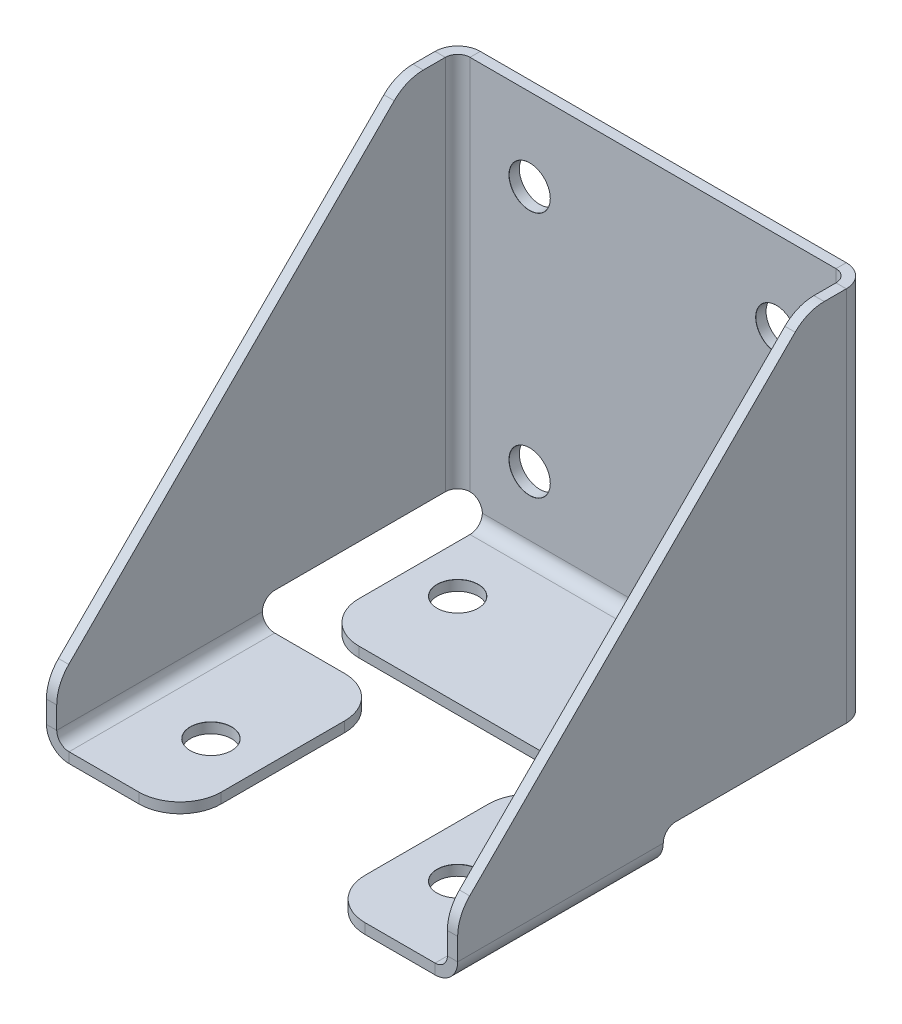
from build123d import *

# Parameters (mm, degrees)
SKETCH1_W                       = 100
SKETCH1_H                       = 100
BASE_FLANGE1_DEPTH              = 2.5
EDGE_FLANGE1_STRIP_W            = 16
EDGE_FLANGE1_STRIP_H            = 2.5
EDGE_FLANGE1_STRIP_CUT_DEPTH    = 83
EDGE_FLANGE1_RELIEF_W           = 17.25
EDGE_FLANGE1_RELIEF_H           = 1.25
EDGE_FLANGE1_RELIEF_CUT_DEPTH   = 2.5
EDGE_FLANGE1_DEPTH              = 83
EDGE_FLANGE2_STRIP_W            = 16
EDGE_FLANGE2_STRIP_H            = 2.5
EDGE_FLANGE2_STRIP_CUT_DEPTH    = 100
EDGE_FLANGE2_DEPTH              = 100
EDGE_FLANGE3_STRIP_W            = 16
EDGE_FLANGE3_STRIP_H            = 2.5
EDGE_FLANGE3_STRIP_CUT_DEPTH    = 50
EDGE_FLANGE3_RELIEF_W           = 17.25
EDGE_FLANGE3_RELIEF_H           = 1.25
EDGE_FLANGE3_RELIEF_CUT_DEPTH   = 2.5
EDGE_FLANGE3_DEPTH              = 50
SKETCH17_W                      = 50
SKETCH17_H                      = 8.5
CUT_EXTRUDE1_DEPTH              = 8.5
CUT_EXTRUDE2_REACH              = 150.345
F_10_0MM_DOWEL_HOLE1_AT_2_COUNT = 2
F_10_0MM_DOWEL_HOLE1_AT_2_PITCH = 60
F_10_0MM_DOWEL_HOLE2_AT_2_COUNT = 2
F_10_0MM_DOWEL_HOLE2_AT_2_PITCH = 60
FILLET3_R                       = 3
FILLET4_R                       = 10


# Sheet-metal steps are written as plain solids
with BuildPart() as part:
    # Sketch1 → Base-Flange1 (new body)
    with BuildSketch(Plane.XY):
        Rectangle(SKETCH1_W, SKETCH1_H)
    extrude(amount=-BASE_FLANGE1_DEPTH)

    # Edge-Flange1 strip (across the edge) → Edge-Flange1 strip cut (cut)
    with BuildSketch(Plane(origin=(-41.5, -50, 0), x_dir=(0, 1, 0), z_dir=(1, 0, 0))):
        with Locations((-2.5, -1.25)):
            Rectangle(EDGE_FLANGE1_STRIP_W, EDGE_FLANGE1_STRIP_H)
    extrude(amount=EDGE_FLANGE1_STRIP_CUT_DEPTH, mode=Mode.SUBTRACT)

    # Edge-Flange1 relief (on the sheet) → Edge-Flange1 relief cut (cut)
    with BuildSketch(Plane(origin=(-41.5, -44.5, 0), x_dir=(0, 1, 0), z_dir=(0, 0, 1))):
        with Locations((-7.375, 0.625)):
            Rectangle(EDGE_FLANGE1_RELIEF_W, EDGE_FLANGE1_RELIEF_H)
        with Locations((-7.375, -83.625)):
            Rectangle(EDGE_FLANGE1_RELIEF_W, EDGE_FLANGE1_RELIEF_H)
    extrude(amount=-EDGE_FLANGE1_RELIEF_CUT_DEPTH, mode=Mode.SUBTRACT)

    # Edge-Flange1 section (across the edge) → Edge-Flange1 (add)
    with BuildSketch(Plane(origin=(-41.5, -50, 0), x_dir=(0, 1, 0), z_dir=(1, 0, 0))):
        with BuildLine():
            Line((0, 3), (0, 40))
            Line((0, 40), (2.5, 40))
            Line((2.5, 40), (2.5, 3))
            ThreePointArc((2.5, 3), (3.378679656, 0.878679656), (5.5, 0))
            Line((5.5, 0), (5.5, -2.5))
            ThreePointArc((5.5, -2.5), (1.610912703, -0.889087297), (0, 3))
        make_face()
    extrude(amount=EDGE_FLANGE1_DEPTH)

    # Edge-Flange2 strip (across the edge) → Edge-Flange2 strip cut (cut)
    with BuildSketch(Plane(origin=(50, -50, 0), x_dir=(-1, 0, 0), z_dir=(0, 1, 0))):
        with Locations((-2.5, -1.25)):
            Rectangle(EDGE_FLANGE2_STRIP_W, EDGE_FLANGE2_STRIP_H)
    edge_flange2_strip_cut = extrude(amount=EDGE_FLANGE2_STRIP_CUT_DEPTH, mode=Mode.SUBTRACT)

    # Edge-Flange2 section (across the edge) → Edge-Flange2 (add)
    with BuildSketch(Plane(origin=(50, -50, 0), x_dir=(-1, 0, 0), z_dir=(0, 1, 0))):
        with BuildLine():
            Line((0, 3), (0, 97.5))
            Line((0, 97.5), (2.5, 97.5))
            Line((2.5, 97.5), (2.5, 3))
            ThreePointArc((2.5, 3), (3.378679656, 0.878679656), (5.5, 0))
            Line((5.5, 0), (5.5, -2.5))
            ThreePointArc((5.5, -2.5), (1.610912703, -0.889087297), (0, 3))
        make_face()
    edge_flange2 = extrude(amount=EDGE_FLANGE2_DEPTH)

    # Edge-Flange3 strip (across the edge) → Edge-Flange3 strip cut (cut)
    with BuildSketch(Plane(origin=(47.5, -50, 47.5), x_dir=(0, 1, 0), z_dir=(0, 0, 1))):
        with Locations((-2.5, -1.25)):
            Rectangle(EDGE_FLANGE3_STRIP_W, EDGE_FLANGE3_STRIP_H)
    edge_flange3_strip_cut = extrude(amount=EDGE_FLANGE3_STRIP_CUT_DEPTH, mode=Mode.SUBTRACT)

    # Edge-Flange3 relief (on the sheet) → Edge-Flange3 relief cut (cut)
    with BuildSketch(Plane(origin=(47.5, -44.5, 47.5), x_dir=(0, 1, 0), z_dir=(-1, 0, 0))):
        with Locations((-7.375, 0.625)):
            Rectangle(EDGE_FLANGE3_RELIEF_W, EDGE_FLANGE3_RELIEF_H)
    edge_flange3_relief_cut = extrude(amount=-EDGE_FLANGE3_RELIEF_CUT_DEPTH, mode=Mode.SUBTRACT)

    # Edge-Flange3 section (across the edge) → Edge-Flange3 (add)
    with BuildSketch(Plane(origin=(47.5, -50, 47.5), x_dir=(0, 1, 0), z_dir=(0, 0, 1))):
        with BuildLine():
            Line((0, 3), (0, 30))
            Line((0, 30), (2.5, 30))
            Line((2.5, 30), (2.5, 3))
            ThreePointArc((2.5, 3), (3.378679656, 0.878679656), (5.5, 0))
            Line((5.5, 0), (5.5, -2.5))
            ThreePointArc((5.5, -2.5), (1.610912703, -0.889087297), (0, 3))
        make_face()
    edge_flange3 = extrude(amount=EDGE_FLANGE3_DEPTH)

    # Sketch17 → Cut-Extrude1 (cut)
    with BuildSketch(Plane(origin=(50, 0, 0), x_dir=(0, 0, -1), z_dir=(1, 0, 0))):
        with Locations((-22.5, -45.75)):
            Rectangle(SKETCH17_W, SKETCH17_H)
    cut_extrude1 = extrude(amount=-CUT_EXTRUDE1_DEPTH, mode=Mode.SUBTRACT)

    # Sketch18 → Cut-Extrude2 (cut, up to next)
    with BuildSketch(Plane(origin=(50, 0, 0), x_dir=(0, 0, -1), z_dir=(1, 0, 0)), mode=Mode.PRIVATE) as cut_extrude2_sk1:
        Polygon((-97.5, 50), (-97.5, -35), (-12.5, 50), align=None)
    cut_extrude2_tool1 = extrude(cut_extrude2_sk1.sketch, amount=-CUT_EXTRUDE2_REACH, mode=Mode.PRIVATE) & part.part
    cut_extrude2 = cut_extrude2_tool1.solids().sort_by_distance((50, 21.666667, 69.166667))[0]
    add(cut_extrude2, mode=Mode.SUBTRACT)

    # Sketch20 → Ø10.0mm Dowel Hole1 (revolve, cut)
    with BuildSketch(Plane(origin=(30, 30, 0), x_dir=(0, -1, 0), z_dir=(1, 0, 0))):
        Polygon((0, 0), (0, 2.5), (5, 2.5), (5, 0.025), (5.025, 0), align=None)
    f_10_0mm_dowel_hole1 = revolve(axis=Axis((30, 30, 6.35), (0, 0, -1)), mode=Mode.SUBTRACT)

    # Ø10.0mm Dowel Hole1 at 2: Ø10.0mm Dowel Hole1 ×2
    with Locations(*[(0, -i * F_10_0MM_DOWEL_HOLE1_AT_2_PITCH, 0) for i in range(1, F_10_0MM_DOWEL_HOLE1_AT_2_COUNT)]):
        add(f_10_0mm_dowel_hole1, mode=Mode.SUBTRACT)

    # Sketch22 → Ø10.0mm Dowel Hole2 (revolve, cut)
    with BuildSketch(Plane(origin=(30, -47.5, 17.5), x_dir=(0, 0, 1), z_dir=(1, 0, 0))):
        Polygon((0, 0), (0, 2.5), (5, 2.5), (5, 0.025), (5.025, 0), align=None)
    f_10_0mm_dowel_hole2 = revolve(axis=Axis((30, -41.15, 17.5), (0, -1, 0)), mode=Mode.SUBTRACT)

    # Ø10.0mm Dowel Hole2 at 2: Ø10.0mm Dowel Hole2 ×2
    with Locations(*[(0, 0, i * F_10_0MM_DOWEL_HOLE2_AT_2_PITCH) for i in range(1, F_10_0MM_DOWEL_HOLE2_AT_2_COUNT)]):
        add(f_10_0mm_dowel_hole2, mode=Mode.SUBTRACT)

    # Mirror3: Edge-Flange2 strip cut, Edge-Flange2, Edge-Flange3 strip cut, Edge-Flange3 relief cut, Edge-Flange3, Cut-Extrude1, Cut-Extrude2, Ø10.0mm Dowel Hole1, Ø10.0mm Dowel Hole2 across plane
    add(edge_flange2_strip_cut.mirror(Plane(origin=(0, 0, 0), x_dir=(0, 0, 1), z_dir=(1, 0, 0))), mode=Mode.SUBTRACT)
    add(edge_flange2.mirror(Plane(origin=(0, 0, 0), x_dir=(0, 0, 1), z_dir=(1, 0, 0))))
    add(edge_flange3_strip_cut.mirror(Plane(origin=(0, 0, 0), x_dir=(0, 0, 1), z_dir=(1, 0, 0))), mode=Mode.SUBTRACT)
    add(edge_flange3_relief_cut.mirror(Plane(origin=(0, 0, 0), x_dir=(0, 0, 1), z_dir=(1, 0, 0))), mode=Mode.SUBTRACT)
    add(edge_flange3.mirror(Plane(origin=(0, 0, 0), x_dir=(0, 0, 1), z_dir=(1, 0, 0))))
    add(cut_extrude1.mirror(Plane(origin=(0, 0, 0), x_dir=(0, 0, 1), z_dir=(1, 0, 0))), mode=Mode.SUBTRACT)
    add(cut_extrude2.mirror(Plane(origin=(0, 0, 0), x_dir=(0, 0, 1), z_dir=(1, 0, 0))), mode=Mode.SUBTRACT)
    add(f_10_0mm_dowel_hole1.mirror(Plane(origin=(0, 0, 0), x_dir=(0, 0, 1), z_dir=(1, 0, 0))), mode=Mode.SUBTRACT)
    add(f_10_0mm_dowel_hole2.mirror(Plane(origin=(0, 0, 0), x_dir=(0, 0, 1), z_dir=(1, 0, 0))), mode=Mode.SUBTRACT)

    # Mirror3 copy 1 sketch → Mirror3 copy 1 (revolve, cut)
    with BuildSketch(Plane(origin=(-30, -30, 0), x_dir=(0, -1, 0), z_dir=(-1, 0, 0))):
        Polygon((0, 0), (0, -2.5), (5, -2.5), (5, -0.025), (5.025, 0), align=None)
    revolve(axis=Axis((-30, -30, 6.35), (0, 0, 1)), mode=Mode.SUBTRACT)

    # Mirror3 copy 2 sketch → Mirror3 copy 2 (revolve, cut)
    with BuildSketch(Plane(origin=(-30, -47.5, 77.5), x_dir=(0, 0, 1), z_dir=(-1, 0, 0))):
        Polygon((0, 0), (0, -2.5), (5, -2.5), (5, -0.025), (5.025, 0), align=None)
    revolve(axis=Axis((-30, -41.15, 77.5), (0, 1, 0)), mode=Mode.SUBTRACT)

    # Fillet3
    fillet3_edges = [part.edges().sort_by_distance(p)[0] for p in [
        (48.75, -41.5, 47.5),
        (41.5, -41.5, -1.25),
        (-48.75, -41.5, 47.5),
        (-41.5, -41.5, -1.25),
    ]]
    fillet(fillet3_edges, radius=FILLET3_R)

    # Fillet4
    fillet4_edges = [part.edges().sort_by_distance(p)[0] for p in [
        (17.5, -48.75, 47.5),
        (17.5, -48.75, 97.5),
        (48.75, 50, 12.5),
        (48.75, -35, 97.5),
        (-17.5, -48.75, 97.5),
        (-17.5, -48.75, 47.5),
        (-48.75, -35, 97.5),
        (-48.75, 50, 12.5),
        (-41.5, -48.75, 40),
        (41.5, -48.75, 40),
    ]]
    fillet(fillet4_edges, radius=FILLET4_R)


solid = part.part
